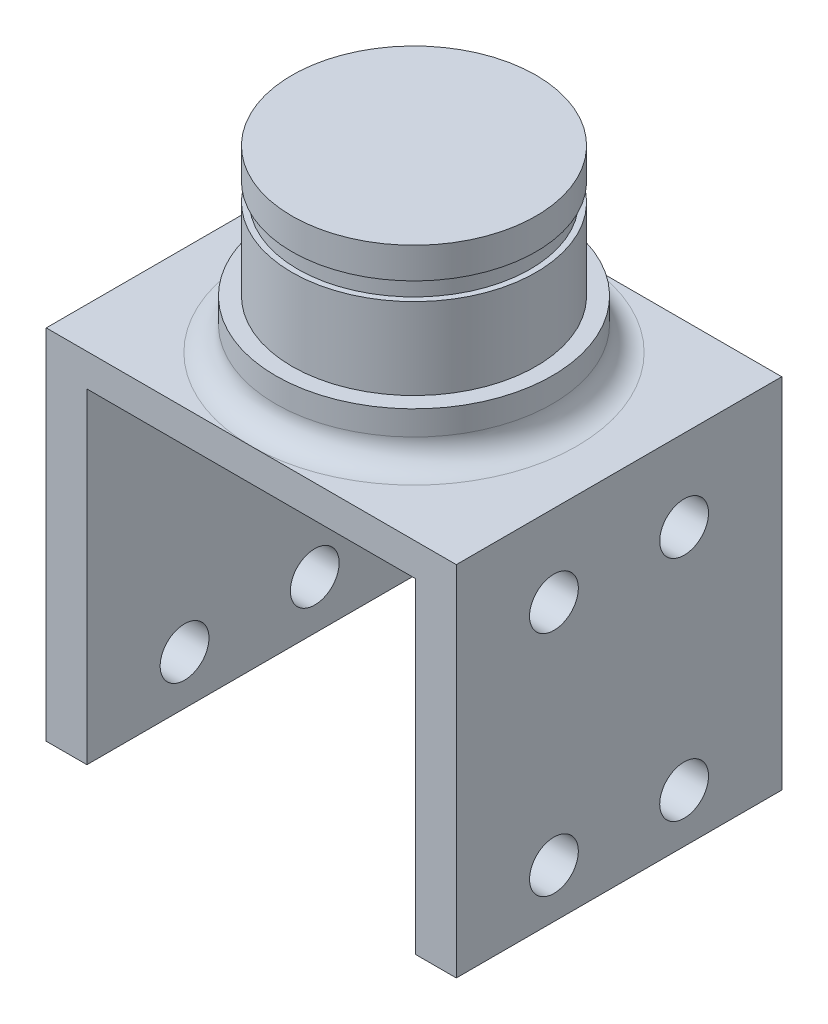
from build123d import *

# Parameters (mm, degrees)
SKETCH_1_W          = 25.2
SKETCH_1_H          = 20
EXTRUDE_1_DEPTH     = 2
SKETCH_2_W          = 2.5
SKETCH_2_H          = 20
EXTRUDE_2_DEPTH     = 20
SKETCH_3_R          = 1.5
CUT_EXTRUDE_1_DEPTH = 34.690354703
SKETCH_4_R          = 8.5
EXTRUDE_3_DEPTH     = 3
SKETCH_5_R          = 7.5
EXTRUDE_4_DEPTH     = 8
SKETCH_6_R          = 7
EXTRUDE_5_DEPTH     = 18
SKETCH_10_R         = 9.319748931
SKETCH_10_W         = 12
SKETCH_10_H         = 12
CUT_EXTRUDE_4_DEPTH = 15
FILLET_2_R          = 1.5
SKETCH_12_R         = 7.5
CUT_EXTRUDE_5_DEPTH = 26
SKETCH_13_W         = 0.35
SKETCH_13_H         = 1.1


with BuildPart() as part:
    # 草图1 → 凸台-拉伸1 (new body)
    with BuildSketch(Plane(origin=(0, 0, 0), x_dir=(1, 0, 0), z_dir=(0, 1, 0))):
        Rectangle(SKETCH_1_W, SKETCH_1_H)
    extrude(amount=EXTRUDE_1_DEPTH)

    # 草图2 → 凸台-拉伸2 (add)
    with BuildSketch(Plane.XZ):
        with Locations((-11.35, 0)):
            Rectangle(SKETCH_2_W, SKETCH_2_H)
        with Locations((11.35, 0)):
            Rectangle(SKETCH_2_W, SKETCH_2_H)
    extrude(amount=EXTRUDE_2_DEPTH)

    # 草图3 → 切除-拉伸1 (cut, through all)
    with BuildSketch(Plane(origin=(12.6, 0, 0), x_dir=(0, 0, -1), z_dir=(1, 0, 0))):
        with Locations((-4, -17)):
            Circle(SKETCH_3_R)
        with Locations((4, -17)):
            Circle(SKETCH_3_R)
        with Locations((4, -3)):
            Circle(SKETCH_3_R)
        with Locations((-4, -3)):
            Circle(SKETCH_3_R)
    extrude(amount=-CUT_EXTRUDE_1_DEPTH, mode=Mode.SUBTRACT)

    # 草图4 → 凸台-拉伸3 (add)
    with BuildSketch(Plane(origin=(0, 2, 0), x_dir=(1, 0, 0), z_dir=(0, 1, 0))):
        with Locations(Location((0, 0, 0), (0, 0, 270))):
            Circle(SKETCH_4_R)
    extrude(amount=EXTRUDE_3_DEPTH)

    # 草图5 → 凸台-拉伸4 (add)
    with BuildSketch(Plane(origin=(0, 5, 0), x_dir=(1, 0, 0), z_dir=(0, 1, 0))):
        with Locations(Location((0, 0, 0), (0, 0, 270))):
            Circle(SKETCH_5_R)
    extrude(amount=EXTRUDE_4_DEPTH)

    # 草图6 → 凸台-拉伸5 (add)
    with BuildSketch(Plane(origin=(0, 13, 0), x_dir=(1, 0, 0), z_dir=(0, 1, 0))):
        with Locations(Location((0, 0, 0), (0, 0, 270))):
            Circle(SKETCH_6_R)
    extrude(amount=EXTRUDE_5_DEPTH)

    # 草图10 → 切除-拉伸4 (cut)
    with BuildSketch(Plane(origin=(0, 31, 0), x_dir=(1, 0, 0), z_dir=(0, 1, 0))):
        Circle(SKETCH_10_R)
        Rectangle(SKETCH_10_W, SKETCH_10_H, mode=Mode.SUBTRACT)
    extrude(amount=-CUT_EXTRUDE_4_DEPTH, mode=Mode.SUBTRACT)

    # 圆角2
    fillet_2_edges = [part.edges().sort_by_distance(p)[0] for p in [
        (0, 2, -8.5),
    ]]
    fillet(fillet_2_edges, radius=FILLET_2_R - 0.0001)  # a hair under: the kernel refuses the full size

    # 草图12 → 切除-拉伸5 (cut)
    with BuildSketch(Plane(origin=(0, 13, 0), x_dir=(1, 0, 0), z_dir=(0, 1, 0))):
        with Locations(Location((0, 0, 0), (0, 0, 270))):
            Circle(SKETCH_12_R)
    extrude(amount=CUT_EXTRUDE_5_DEPTH, mode=Mode.SUBTRACT)

    # 草图13 → 切除-旋转1 (revolve, cut)
    with BuildSketch(Plane(origin=(0, 0, 0), x_dir=(0, 0, -1), z_dir=(1, 0, 0)), mode=Mode.PRIVATE) as cut_revolve_1_sk:
        with Locations((7.325, 10.55)):
            Rectangle(SKETCH_13_W, SKETCH_13_H)
    revolve(cut_revolve_1_sk.sketch.rotate(Axis((0, 13, 0), (0, -1, 0)), 180), axis=Axis((0, 13, 0), (0, -1, 0)), mode=Mode.SUBTRACT)


solid = part.part
